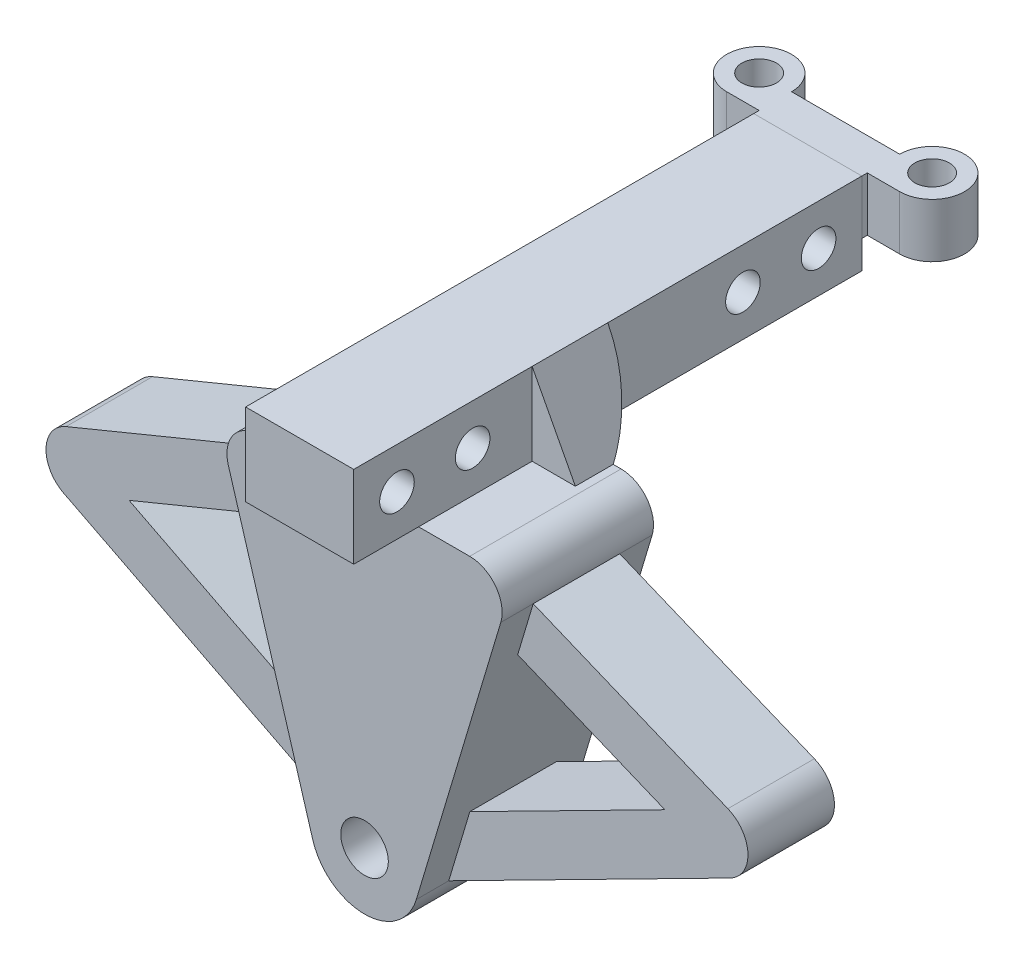
from build123d import *

# Parameters (mm, degrees)
SKETCH_1_W             = 47
SKETCH_1_H             = 7.6
SKETCH_1_R             = 1.6
EXTRUDE_1_DEPTH        = 5
EXTRUDE_3_DEPTH        = 7
SKETCH_3_R             = 2.2
EXTRUDE_2_DEPTH        = 7
FILLET_1_R             = 5
FILLET_2_R             = 3
FILLET_4_R             = 10
EXTRUDE_4_DEPTH        = 4
FILLET_3_R             = 3
FILLET_3_OF_MIRROR_1_R = 3
SKETCH_6_R             = 1.6
EXTRUDE_5_DEPTH        = 5


with BuildPart() as part:
    # 草图1 → 凸台-拉伸1 (new, symmetric)
    with BuildSketch(Plane(origin=(0, 0, 0), x_dir=(0, 0, -1), z_dir=(1, 0, 0))):
        Rectangle(SKETCH_1_W, SKETCH_1_H)
        with Locations((-19.5, 0)):
            Circle(SKETCH_1_R, mode=Mode.SUBTRACT)
        with Locations((-12.5, 0)):
            Circle(SKETCH_1_R, mode=Mode.SUBTRACT)
        with Locations(Location((12.5, 0, 0), (0, 0, 180))):
            Circle(SKETCH_1_R, mode=Mode.SUBTRACT)
        with Locations(Location((19.5, 0, 0), (0, 0, 180))):
            Circle(SKETCH_1_R, mode=Mode.SUBTRACT)
    extrude(amount=EXTRUDE_1_DEPTH, both=True)

    # 草图4 → 凸台-拉伸3 (add)
    with BuildSketch(Plane.XY):
        Polygon((5, 3.8), (5, -3.8), (9, -3.8), align=None)
        Polygon((-5, -3.8), (-9, -3.8), (-5, 3.8), align=None)
    extrude(amount=EXTRUDE_3_DEPTH)

    # 草图3 → 凸台-拉伸2 (add, symmetric)
    with BuildSketch(Plane.XY.offset(10.5)):
        Polygon((0, -3.8), (-13.756900678, -3.8), (0, -49.766728974), (13.756900678, -3.8), align=None)
        with Locations((0, -32.020277262)):
            Circle(SKETCH_3_R, mode=Mode.SUBTRACT)
    extrude(amount=EXTRUDE_2_DEPTH, both=True)

    # 圆角1
    fillet_1_edges = [part.edges().sort_by_distance(p)[0] for p in [
        (0, -49.766728974, 10.5),
    ]]
    fillet(fillet_1_edges, radius=FILLET_1_R)

    # 圆角2
    fillet_2_edges = [part.edges().sort_by_distance(p)[0] for p in [
        (13.756900678, -3.8, 10.5),
        (-13.756900678, -3.8, 10.5),
    ]]
    fillet(fillet_2_edges, radius=FILLET_2_R)

    # 圆角4
    # the kernel refuses this fillet: 10 mm, written as the material it takes off along each edge
    with BuildSketch(Plane(origin=(13.998355192, -3.8, 0), x_dir=(0, 0, 1), z_dir=(-1, 0, 0))) as fillet_4_piece_1_section:
        with BuildLine():
            CenterArc((10, 7.599342077), FILLET_4_R, 180, 49.458398126)
            Line((0, 7.599342077), (-0.2, 7.599342077))
            Line((-0.2, 7.599342077), (-0.2, 0))
            Line((-0.2, 0), (0, -0.2))
            ThreePointArc((0, -0.2), (1.75, -0.2), (3.37, -0.151986842))
            Line((3.37, -0.151986842), (3.5, 0))
        make_face()
    fillet_4_piece_1 = extrude(amount=41.996710384, mode=Mode.PRIVATE)
    fillet_4_piece_1 = split(fillet_4_piece_1, bisect_by=Plane(origin=(5, -1.809246977, 0.883967922), z_dir=(1, 0, 0)), keep=Keep.TOP, mode=Mode.PRIVATE)
    add(fillet_4_piece_1, mode=Mode.SUBTRACT)
    with BuildSketch(Plane(origin=(-5, -3.8, 0), x_dir=(0, 0, 1), z_dir=(-1, 0, 0))) as fillet_4_piece_2:
        with BuildLine():
            CenterArc((10, 7.599342077), FILLET_4_R, 180, 49.458398126)
            Line((0, 7.599342077), (-0.2, 7.599342077))
            Line((-0.2, 7.599342077), (-0.2, 0))
            Line((-0.2, 0), (0, -0.2))
            ThreePointArc((0, -0.2), (1.75, -0.2), (3.37, -0.151986842))
            Line((3.37, -0.151986842), (3.5, 0))
        make_face()
    extrude(amount=22.998355192, mode=Mode.SUBTRACT)
    with BuildSketch(Plane(origin=(-13.998355192, -3.8, 0), x_dir=(0, 0, 1), z_dir=(1, 0, 0))) as fillet_4_piece_3_section:
        with BuildLine():
            CenterArc((10, -7.599342077), FILLET_4_R, 130.541601874, 49.458398126)
            Line((0, -7.599342077), (-0.2, -7.599342077))
            Line((-0.2, -7.599342077), (-0.2, 0))
            Line((-0.2, 0), (0, 0.2))
            ThreePointArc((0, 0.2), (1.75, 0.2), (3.37, 0.151986842))
            Line((3.37, 0.151986842), (3.5, 0))
        make_face()
    fillet_4_piece_3 = extrude(amount=41.996710384, mode=Mode.PRIVATE)
    fillet_4_piece_3 = split(fillet_4_piece_3, bisect_by=Plane(origin=(-5, -1.809246977, 0.883967922), z_dir=(-1, 0, 0)), keep=Keep.TOP, mode=Mode.PRIVATE)
    add(fillet_4_piece_3, mode=Mode.SUBTRACT)
    with BuildSketch(Plane(origin=(5, -3.8, 0), x_dir=(0, 0, 1), z_dir=(1, 0, 0))) as fillet_4_piece_4:
        with BuildLine():
            CenterArc((10, -7.599342077), FILLET_4_R, 130.541601874, 49.458398126)
            Line((0, -7.599342077), (-0.2, -7.599342077))
            Line((-0.2, -7.599342077), (-0.2, 0))
            Line((-0.2, 0), (0, 0.2))
            ThreePointArc((0, 0.2), (1.75, 0.2), (3.37, 0.151986842))
            Line((3.37, 0.151986842), (3.5, 0))
        make_face()
    extrude(amount=22.998355192, mode=Mode.SUBTRACT)

    # 草图5 → 凸台-拉伸4 (add, symmetric)
    with BuildSketch(Plane.XY.offset(10.5)):
        Polygon((-12.6016387, -7.660143754), (-36.64770265, -17.562543764), (-4.790080237, -33.761356459), (-6.740083912, -27.245696244), (-24.782770498, -18.071436573), (-11.164189994, -12.463174365), align=None)
    extrude_4 = extrude(amount=EXTRUDE_4_DEPTH, both=True)

    # 圆角3
    fillet_3_edges = [part.edges().sort_by_distance(p)[0] for p in [
        (-36.64770265, -17.562543764, 10.5),
    ]]
    fillet(fillet_3_edges, radius=FILLET_3_R)

    # 镜向1: 凸台-拉伸4 across plane
    add(extrude_4.mirror(Plane(origin=(0, 0, 0), x_dir=(0, 0, 1), z_dir=(1, 0, 0))))

    # 圆角3 of 镜向1
    fillet_3_of_mirror_1_edges = [part.edges().sort_by_distance(p)[0] for p in [
        (36.64770265, -17.562543764, 10.5),
    ]]
    fillet(fillet_3_of_mirror_1_edges, radius=FILLET_3_OF_MIRROR_1_R)


with BuildPart() as body_2:
    # 草图6 → 凸台-拉伸5 (new body)
    with BuildSketch(Plane(origin=(0, 3.8, 0), x_dir=(1, 0, 0), z_dir=(0, 1, 0))):
        with BuildLine():
            Line((-5, 23.5), (-5, 24))
            Line((-5, 24), (-8, 24))
            ThreePointArc((-8, 24), (-10.121320344, 29.121320344), (-5, 27))
            Line((-5, 27), (5, 27))
            ThreePointArc((5, 27), (10.121320344, 29.121320344), (8, 24))
            Line((8, 24), (5, 24))
            Line((5, 24), (5, 23.5))
            Line((5, 23.5), (-5, 23.5))
        make_face()
        with Locations(Location((-8, 27, 0), (0, 0, 270))):
            Circle(SKETCH_6_R, mode=Mode.SUBTRACT)
        with Locations(Location((8, 27, 0), (0, 0, 90))):
            Circle(SKETCH_6_R, mode=Mode.SUBTRACT)
    extrude(amount=-EXTRUDE_5_DEPTH)


solid = Compound([part.part, body_2.part])
